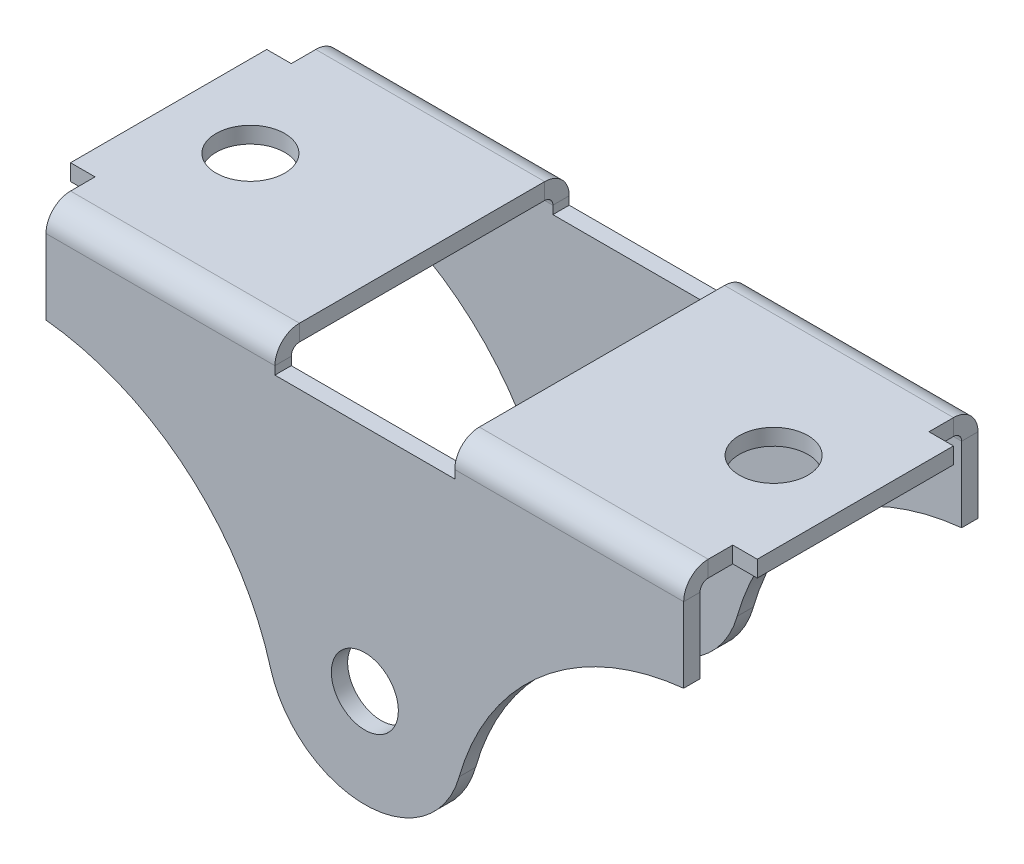
from build123d import *

# Parameters (mm, degrees)
SKETCH_1_R                       = 2.05
SM_BASE_FLANGE_2_DEPTH           = 1
SM_EDGE_FLANGE_1_STRIP_W         = 5
SM_EDGE_FLANGE_1_STRIP_H         = 1
SM_EDGE_FLANGE_1_STRIP_CUT_DEPTH = 42
SM_EDGE_FLANGE_1_DEPTH           = 42
SKETCH_13_W                      = 11
SKETCH_13_H                      = 2
CUT_EXTRUDE_1_DEPTH              = 35.727510708
SKETCH_14_R                      = 2.1
SKETCH_14_W                      = 1.5
SKETCH_14_H                      = 3
CUT_EXTRUDE_2_DEPTH              = 36.341194094


# Sheet-metal steps are written as plain solids
with BuildPart() as part:
    # Sketch 1 → Базовая кромка2 (new body)
    with BuildSketch(Plane.XY):
        with BuildLine():
            Line((-21, -5), (-21, 0))
            Line((-21, 0), (21, 0))
            Line((21, 0), (21, -5))
            ThreePointArc((21, -5), (11.451449282, -8.286050683), (5.772615091, -16.636128055))
            ThreePointArc((5.772615091, -16.636128055), (0, -21), (-5.772615091, -16.636128055))
            ThreePointArc((-5.772615091, -16.636128055), (-11.451449282, -8.286050683), (-21, -5))
        make_face()
        with Locations((0, -15)):
            Circle(SKETCH_1_R, mode=Mode.SUBTRACT)
    extrude(amount=-SM_BASE_FLANGE_2_DEPTH)

    # Ребро-кромка1 strip (across the edge) → Ребро-кромка1 strip cut (cut)
    with BuildSketch(Plane(origin=(-21, 0, -1), x_dir=(0, -1, 0), z_dir=(1, 0, 0))):
        with Locations((-2, -0.5)):
            Rectangle(SM_EDGE_FLANGE_1_STRIP_W, SM_EDGE_FLANGE_1_STRIP_H)
    extrude(amount=SM_EDGE_FLANGE_1_STRIP_CUT_DEPTH, mode=Mode.SUBTRACT)

    # Ребро-кромка1 section (across the edge) → Ребро-кромка1 (add)
    with BuildSketch(Plane(origin=(-21, 0, -1), x_dir=(0, -1, 0), z_dir=(1, 0, 0))):
        with BuildLine():
            Line((-1, 0.5), (-1, 8))
            Line((-1, 8), (0, 8))
            Line((0, 8), (0, 0.5))
            ThreePointArc((0, 0.5), (0.146446609, 0.146446609), (0.5, 0))
            Line((0.5, 0), (0.5, -1))
            ThreePointArc((0.5, -1), (-0.560660172, -0.560660172), (-1, 0.5))
        make_face()
    extrude(amount=SM_EDGE_FLANGE_1_DEPTH)

    # Зеркальное отражение1: part across plane


with BuildPart() as part_1:
    add(part.part)
    add(part.part.mirror(Plane(origin=(-21, 1, -9), x_dir=(1, 0, 0), z_dir=(0, 0, 1))))

    # Эскиз13 → Вырез-Вытянуть1 (cut, through all)
    with BuildSketch(Plane.XY):
        Rectangle(SKETCH_13_W, SKETCH_13_H)
    extrude(amount=-CUT_EXTRUDE_1_DEPTH, mode=Mode.SUBTRACT)

    # Эскиз14 → Вырез-Вытянуть2 (cut, through all)
    with BuildSketch(Plane(origin=(0, 1, 0), x_dir=(1, 0, 0), z_dir=(0, 1, 0))):
        with Locations(Location((-16, 9, 0), (0, 0, 90))):
            Circle(SKETCH_14_R)
        with Locations(Location((16, 9, 0), (0, 0, 90))):
            Circle(SKETCH_14_R)
        with Locations((-20.25, 16.5)):
            Rectangle(SKETCH_14_W, SKETCH_14_H)
        with Locations((-20.25, 1.5)):
            Rectangle(SKETCH_14_W, SKETCH_14_H)
        with Locations((20.25, 1.5)):
            Rectangle(SKETCH_14_W, SKETCH_14_H)
        with Locations((20.25, 16.5)):
            Rectangle(SKETCH_14_W, SKETCH_14_H)
    extrude(amount=-CUT_EXTRUDE_2_DEPTH, mode=Mode.SUBTRACT)


solid = part_1.part
